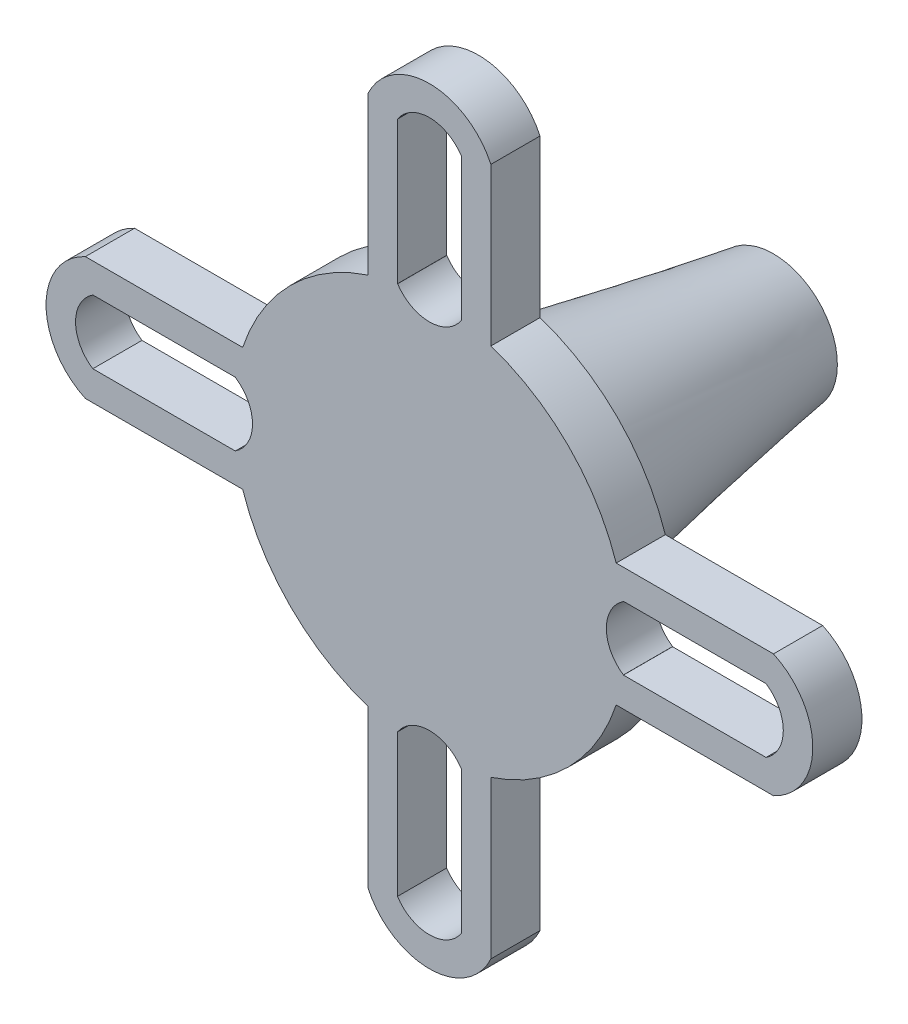
from build123d import *

# Parameters (mm, degrees)
BOSS_EXTRUDE1_DEPTH = 2.5
SKETCH16_R          = 2.225
CUT_EXTRUDE2_DEPTH  = 15


with BuildPart() as part:
    # Sketch1 → Boss-Extrude1 (new body)
    with BuildSketch(Plane.XY):
        with BuildLine():
            Line((3.125, -17.5), (3.125, -9.499177596))
            ThreePointArc((3.125, -9.499177596), (7.071067812, -7.071067812), (9.499177596, -3.125))
            Line((9.499177596, -3.125), (17.5, -3.125))
            ThreePointArc((17.5, -3.125), (19.5, 0), (17.5, 3.125))
            Line((17.5, 3.125), (9.499177596, 3.125))
            ThreePointArc((9.499177596, 3.125), (7.071067812, 7.071067812), (3.125, 9.499177596))
            Line((3.125, 9.499177596), (3.125, 17.5))
            ThreePointArc((3.125, 17.5), (0, 19.5), (-3.125, 17.5))
            Line((-3.125, 17.5), (-3.125, 9.499177596))
            ThreePointArc((-3.125, 9.499177596), (-7.071067812, 7.071067812), (-9.499177596, 3.125))
            Line((-9.499177596, 3.125), (-17.5, 3.125))
            ThreePointArc((-17.5, 3.125), (-19.5, 0), (-17.5, -3.125))
            Line((-17.5, -3.125), (-9.499177596, -3.125))
            ThreePointArc((-9.499177596, -3.125), (-7.071067812, -7.071067812), (-3.125, -9.499177596))
            Line((-3.125, -9.499177596), (-3.125, -17.5))
            ThreePointArc((-3.125, -17.5), (0, -19.5), (3.125, -17.5))
        make_face()
        with BuildLine():
            ThreePointArc((-9.868180698, -1.618335477), (-9.86763363, -1.621667831), (-9.867085436, -1.625))
            Line((-9.867085436, -1.625), (-9.878306468, -1.625))
            Line((-9.878306468, -1.625), (-17.120871128, -1.625))
            ThreePointArc((-17.120871128, -1.625), (-18, 0), (-17.120871128, 1.625))
            Line((-17.120871128, 1.625), (-9.878306468, 1.625))
            Line((-9.878306468, 1.625), (-9.867085436, 1.625))
            ThreePointArc((-9.867085436, 1.625), (-9.86763363, 1.621667831), (-9.868180698, 1.618335477))
            ThreePointArc((-9.868180698, 1.618335477), (-8.999177596, 0), (-9.868180698, -1.618335477))
        make_face(mode=Mode.SUBTRACT)
        with BuildLine():
            ThreePointArc((-1.618335477, -9.868180698), (0, -8.999177596), (1.618335477, -9.868180698))
            ThreePointArc((1.618335477, -9.868180698), (1.621667831, -9.86763363), (1.625, -9.867085436))
            Line((1.625, -9.867085436), (1.625, -9.878306468))
            Line((1.625, -9.878306468), (1.625, -17.120871128))
            ThreePointArc((1.625, -17.120871128), (0, -18), (-1.625, -17.120871128))
            Line((-1.625, -17.120871128), (-1.625, -9.878306468))
            Line((-1.625, -9.878306468), (-1.625, -9.867085436))
            ThreePointArc((-1.625, -9.867085436), (-1.621667831, -9.86763363), (-1.618335477, -9.868180698))
        make_face(mode=Mode.SUBTRACT)
        with BuildLine():
            Line((1.625, 9.878306468), (1.625, 9.867085436))
            ThreePointArc((1.625, 9.867085436), (1.621667831, 9.86763363), (1.618335477, 9.868180698))
            ThreePointArc((1.618335477, 9.868180698), (0, 8.999177596), (-1.618335477, 9.868180698))
            ThreePointArc((-1.618335477, 9.868180698), (-1.621667831, 9.86763363), (-1.625, 9.867085436))
            Line((-1.625, 9.867085436), (-1.625, 9.878306468))
            Line((-1.625, 9.878306468), (-1.625, 17.120871128))
            ThreePointArc((-1.625, 17.120871128), (0, 18), (1.625, 17.120871128))
            Line((1.625, 17.120871128), (1.625, 9.878306468))
        make_face(mode=Mode.SUBTRACT)
        with BuildLine():
            ThreePointArc((9.868180698, 1.618335477), (9.86763363, 1.621667831), (9.867085436, 1.625))
            Line((9.867085436, 1.625), (9.878306468, 1.625))
            Line((9.878306468, 1.625), (17.120871128, 1.625))
            ThreePointArc((17.120871128, 1.625), (18, 0), (17.120871128, -1.625))
            Line((17.120871128, -1.625), (9.878306468, -1.625))
            Line((9.878306468, -1.625), (9.867085436, -1.625))
            ThreePointArc((9.867085436, -1.625), (9.86763363, -1.621667831), (9.868180698, -1.618335477))
            ThreePointArc((9.868180698, -1.618335477), (8.999177596, 0), (9.868180698, 1.618335477))
        make_face(mode=Mode.SUBTRACT)
    extrude(amount=BOSS_EXTRUDE1_DEPTH)

    # Loft2: read off the stored shape, not the designer's step
    # Loft2: loft between two sections, ruled curve by curve
    loft2_from = [
        Edge.make_bspline([(3.048060313, 1.127753665, -15), (0.792552983, 7.223874291, -15), (-5.303567643, 4.968366961, -15), (-3.048060313, -1.127753665, -15), (-0.792552983, -7.223874291, -15), (5.303567643, -4.968366961, -15), (3.048060313, 1.127753665, -15)], [0, 0, 0, 0, 0.5, 0.5, 0.5, 1, 1, 1, 1], 3, [1, 0.333333333, 0.333333333, 1, 0.333333333, 0.333333333, 1]),
    ]
    loft2_to = [
        Edge.make_bspline([(4.41488096, 4.063105476, 0), (-3.711329991, 12.892867396, 0), (-12.541091911, 4.766656445, 0), (-4.41488096, -4.063105476, 0), (3.711329991, -12.892867396, 0), (12.541091911, -4.766656445, 0), (4.41488096, 4.063105476, 0)], [0, 0, 0, 0, 0.5, 0.5, 0.5, 1, 1, 1, 1], 3, [1, 0.333333333, 0.333333333, 1, 0.333333333, 0.333333333, 1]),
    ]
    loft2 = Solid(Shell([*[Face.make_surface_from_curves(loft2_from[k], loft2_to[k]) for k in range(1)], Face(Wire(loft2_from)), Face(Wire(loft2_to))]))
    add(loft2)

    # Sketch16 → Cut-Extrude2 (cut)
    with BuildSketch(Plane(origin=(0, 0, -15), x_dir=(-1, 0, 0), z_dir=(0, 0, -1))):
        Circle(SKETCH16_R)
    extrude(amount=-CUT_EXTRUDE2_DEPTH, mode=Mode.SUBTRACT)


solid = part.part
